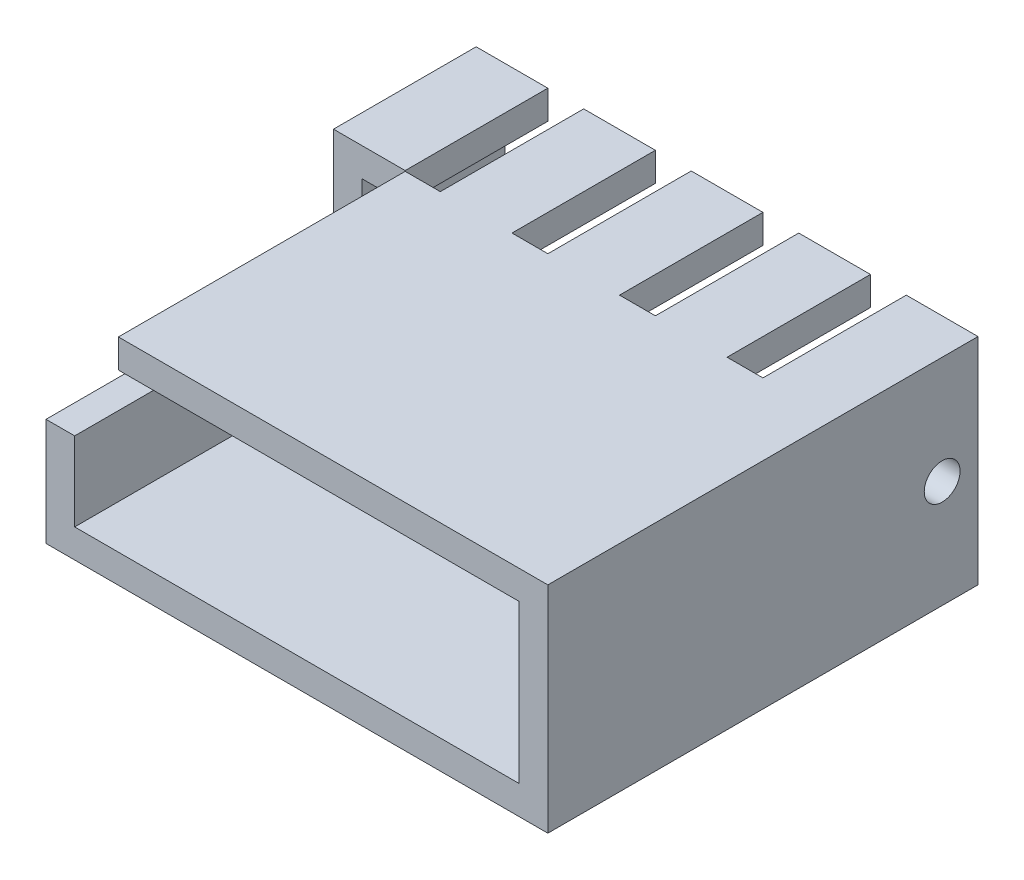
from build123d import *

# Parameters (mm, degrees)
SKETCH1_W               = 88.9
SKETCH1_H               = 76.2
BOSS_EXTRUDE1_DEPTH     = 38.1
SHELL1_T                = -5.08
CUT_EXTRUDE3_START      = -19.05
SKETCH4_W               = 12.827
SKETCH4_H               = 50.927
CUT_EXTRUDE3_DEPTH      = 105.081068378
SKETCH5_W               = 6.35
SKETCH5_H               = 25.4
CUT_EXTRUDE4_DEPTH      = 124.131068378
CUT_EXTRUDE5_DEPTH      = 4.2672
CUT_EXTRUDE5_DEPTH_BACK = 124.131068378
SKETCH6_R               = 3.175


with BuildPart() as part:
    # Sketch1 → Boss-Extrude1 (new body)
    with BuildSketch(Plane(origin=(0, 0, 0), x_dir=(1, 0, 0), z_dir=(0, 1, 0))):
        with Locations((44.45, 38.1)):
            Rectangle(SKETCH1_W, SKETCH1_H)
    extrude(amount=BOSS_EXTRUDE1_DEPTH)

    # Shell1
    shell1_openings = [part.faces().sort_by_distance(p)[0] for p in [
        (44.45, 19.05, -76.2),
        (44.45, 19.05, 0),
    ]]
    offset(amount=SHELL1_T, openings=shell1_openings, kind=Kind.INTERSECTION)

    # Sketch4 → Cut-Extrude3 (cut, through all)
    with BuildSketch(Plane.XZ.offset(CUT_EXTRUDE3_START)):
        with Locations((6.4135, -25.4635)):
            Rectangle(SKETCH4_W, SKETCH4_H)
    extrude(amount=-CUT_EXTRUDE3_DEPTH, mode=Mode.SUBTRACT)

    # Sketch5 → Cut-Extrude4 (cut, through all)
    with BuildSketch(Plane(origin=(0, 38.1, 0), x_dir=(1, 0, 0), z_dir=(0, 1, 0))):
        with Locations((15.875, 63.5)):
            Rectangle(SKETCH5_W, SKETCH5_H)
        with Locations((34.925, 63.5)):
            Rectangle(SKETCH5_W, SKETCH5_H)
        with Locations((53.975, 63.5)):
            Rectangle(SKETCH5_W, SKETCH5_H)
        with Locations((73.025, 63.5)):
            Rectangle(SKETCH5_W, SKETCH5_H)
    extrude(amount=-CUT_EXTRUDE4_DEPTH, mode=Mode.SUBTRACT)

    # Sketch6 → Cut-Extrude5 (cut, two sides: drawn at the far end of the back side and taken through both)
    with BuildSketch(Plane.ZY.offset(-CUT_EXTRUDE5_DEPTH_BACK)):
        with Locations((-69.85, 19.05)):
            Circle(SKETCH6_R)
    extrude(amount=CUT_EXTRUDE5_DEPTH + CUT_EXTRUDE5_DEPTH_BACK, mode=Mode.SUBTRACT)


solid = part.part
